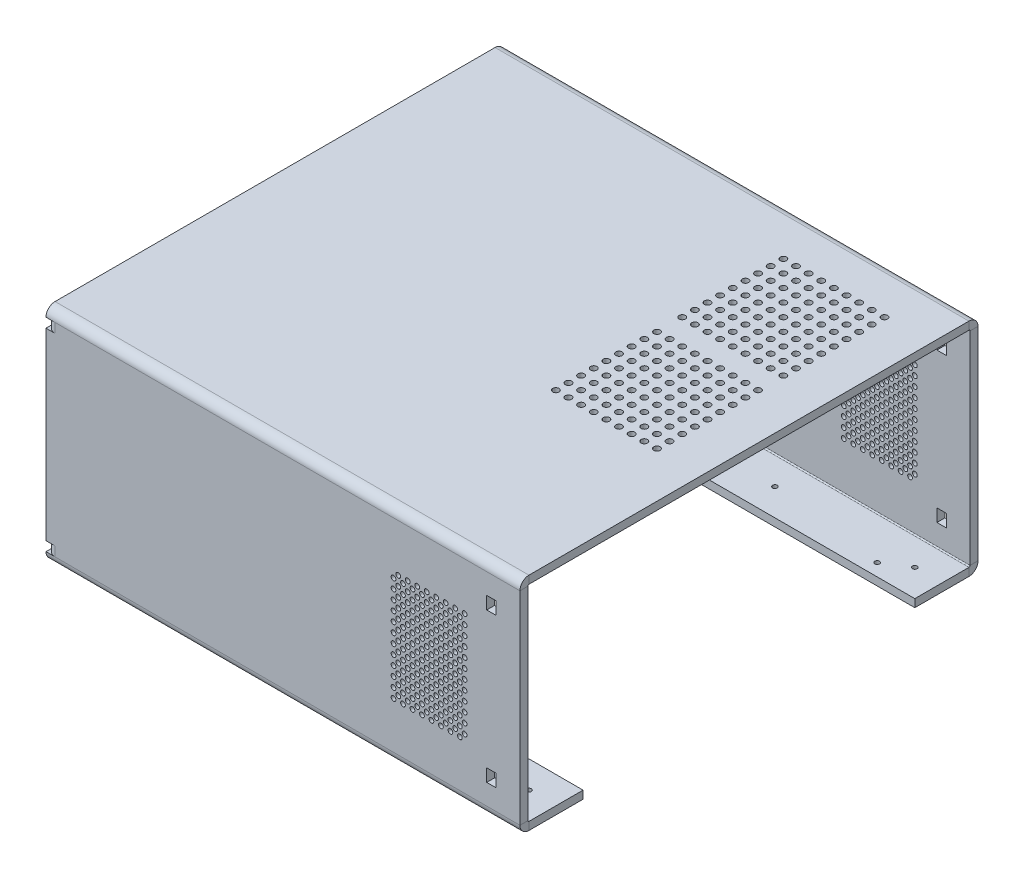
from build123d import *

# Parameters (mm, degrees)
SKETCH1_W                         = 300
SKETCH1_H                         = 280
TOP_SURFACE_DEPTH                 = 5
SIDES_STRIP_W                     = 21.4732
SIDES_STRIP_H                     = 5
SIDES_STRIP_CUT_DEPTH             = 300
SIDES_STRIP_2_W                   = 21.4732
SIDES_STRIP_2_H                   = 5
SIDES_STRIP_CUT_2_DEPTH           = 300
SIDES_DEPTH                       = 300
SIDES_BEND_DEPTH                  = 300
BOTTOM_SURFACES_STRIP_W           = 21.4732
BOTTOM_SURFACES_STRIP_H           = 5
BOTTOM_SURFACES_STRIP_CUT_DEPTH   = 300
BOTTOM_SURFACES_STRIP_2_W         = 21.4732
BOTTOM_SURFACES_STRIP_2_H         = 5
BOTTOM_SURFACES_STRIP_CUT_2_DEPTH = 300
BOTTOM_SURFACES_DEPTH             = 300
BOTTOM_SURFACES_BEND_DEPTH        = 300
SKETCH27_R                        = 1.5
SCREW_HOLES_BOTTOM_DEPTH          = 5
EDGE_FLANGE4_STRIP_W              = 21.4732
EDGE_FLANGE4_STRIP_H              = 5
EDGE_FLANGE4_STRIP_CUT_DEPTH      = 6
EDGE_FLANGE4_DEPTH                = 6
EDGE_FLANGE5_STRIP_W              = 21.4732
EDGE_FLANGE5_STRIP_H              = 5
EDGE_FLANGE5_STRIP_CUT_DEPTH      = 6
EDGE_FLANGE5_DEPTH                = 6
EDGE_FLANGE6_STRIP_W              = 21.4732
EDGE_FLANGE6_STRIP_H              = 5
EDGE_FLANGE6_STRIP_CUT_DEPTH      = 6
EDGE_FLANGE6_DEPTH                = 6
EDGE_FLANGE7_STRIP_W              = 21.4732
EDGE_FLANGE7_STRIP_H              = 5
EDGE_FLANGE7_STRIP_CUT_DEPTH      = 6
EDGE_FLANGE7_DEPTH                = 6
SKETCH40_R                        = 1.5
CUT_EXTRUDE3_DEPTH                = 5
SKETCH42_R                        = 1.5
SIDE_AIR_VENTS_DEPTH              = 441.113621693
SKETCH46_R                        = 2
TOP_AIR_VENTS_DEPTH               = 5
SNAP_HOOK_GROVES_REACH            = 442.114
SKETCH43_W                        = 6
SKETCH43_H                        = 8
SKETCH47_R                        = 1.5
CUT_EXTRUDE4_DEPTH                = 10


# Sheet-metal steps are written as plain solids
with BuildPart() as part:
    # Sketch1 → Top Surface (new body)
    with BuildSketch(Plane(origin=(0, 0, 0), x_dir=(1, 0, 0), z_dir=(0, 1, 0))):
        with Locations((150, -140)):
            Rectangle(SKETCH1_W, SKETCH1_H)
    extrude(amount=-TOP_SURFACE_DEPTH)

    # Sides strip (across the edge) → Sides strip cut (cut)
    with BuildSketch(Plane(origin=(300, -5, 280), x_dir=(0, 0, -1), z_dir=(-1, 0, 0))):
        with Locations((-10, -2.5)):
            Rectangle(SIDES_STRIP_W, SIDES_STRIP_H)
    extrude(amount=SIDES_STRIP_CUT_DEPTH, mode=Mode.SUBTRACT)

    # Sides strip 2 (across the edge) → Sides strip cut 2 (cut)
    with BuildSketch(Plane(origin=(0, -5, 0), x_dir=(0, 0, 1), z_dir=(1, 0, 0))):
        with Locations((-10, -2.5)):
            Rectangle(SIDES_STRIP_2_W, SIDES_STRIP_2_H)
    extrude(amount=SIDES_STRIP_CUT_2_DEPTH, mode=Mode.SUBTRACT)

    # Sides section (across the edge) → Sides (add)
    with BuildSketch(Plane(origin=(300, -5, 280), x_dir=(0, 0, -1), z_dir=(-1, 0, 0))):
        with BuildLine():
            Line((-5, 0.7366), (-5, 135))
            Line((-5, 135), (0, 135))
            Line((0, 135), (0, 0.7366))
            ThreePointArc((0, 0.7366), (0.215745145, 0.215745145), (0.7366, 0))
            Line((0.7366, 0), (0.7366, -5))
            ThreePointArc((0.7366, -5), (-3.319788761, -3.319788761), (-5, 0.7366))
        make_face()
    extrude(amount=SIDES_DEPTH)

    # Sides section 2 (across the edge) → Sides bend (add)
    with BuildSketch(Plane(origin=(0, -5, 0), x_dir=(0, 0, 1), z_dir=(1, 0, 0))):
        with BuildLine():
            Line((-5, 0.7366), (-5, 135))
            Line((-5, 135), (0, 135))
            Line((0, 135), (0, 0.7366))
            ThreePointArc((0, 0.7366), (0.215745145, 0.215745145), (0.7366, 0))
            Line((0.7366, 0), (0.7366, -5))
            ThreePointArc((0.7366, -5), (-3.319788761, -3.319788761), (-5, 0.7366))
        make_face()
    extrude(amount=SIDES_BEND_DEPTH)

    # Bottom surfaces strip (across the edge) → Bottom surfaces strip cut (cut)
    with BuildSketch(Plane(origin=(300, -140, 280), x_dir=(0, 1, 0), z_dir=(-1, 0, 0))):
        with Locations((-5, -2.5)):
            Rectangle(BOTTOM_SURFACES_STRIP_W, BOTTOM_SURFACES_STRIP_H)
    extrude(amount=BOTTOM_SURFACES_STRIP_CUT_DEPTH, mode=Mode.SUBTRACT)

    # Bottom surfaces strip 2 (across the edge) → Bottom surfaces strip cut 2 (cut)
    with BuildSketch(Plane(origin=(0, -140, 0), x_dir=(0, 1, 0), z_dir=(1, 0, 0))):
        with Locations((-5, -2.5)):
            Rectangle(BOTTOM_SURFACES_STRIP_2_W, BOTTOM_SURFACES_STRIP_2_H)
    extrude(amount=BOTTOM_SURFACES_STRIP_CUT_2_DEPTH, mode=Mode.SUBTRACT)

    # Bottom surfaces section (across the edge) → Bottom surfaces (add)
    with BuildSketch(Plane(origin=(300, -140, 280), x_dir=(0, 1, 0), z_dir=(-1, 0, 0))):
        with BuildLine():
            Line((0, 0.7366), (0, 35))
            Line((0, 35), (5, 35))
            Line((5, 35), (5, 0.7366))
            ThreePointArc((5, 0.7366), (5.215745145, 0.215745145), (5.7366, 0))
            Line((5.7366, 0), (5.7366, -5))
            ThreePointArc((5.7366, -5), (1.680211239, -3.319788761), (0, 0.7366))
        make_face()
    extrude(amount=BOTTOM_SURFACES_DEPTH)

    # Bottom surfaces section 2 (across the edge) → Bottom surfaces bend (add)
    with BuildSketch(Plane(origin=(0, -140, 0), x_dir=(0, 1, 0), z_dir=(1, 0, 0))):
        with BuildLine():
            Line((0, 0.7366), (0, 35))
            Line((0, 35), (5, 35))
            Line((5, 35), (5, 0.7366))
            ThreePointArc((5, 0.7366), (5.215745145, 0.215745145), (5.7366, 0))
            Line((5.7366, 0), (5.7366, -5))
            ThreePointArc((5.7366, -5), (1.680211239, -3.319788761), (0, 0.7366))
        make_face()
    extrude(amount=BOTTOM_SURFACES_BEND_DEPTH)

    # Sketch27 → Screw Holes Bottom (cut)
    with BuildSketch(Plane(origin=(0, -135, 0), x_dir=(1, 0, 0), z_dir=(0, 1, 0))):
        with Locations(Location((17.1317, -17.8683, 0), (0, 0, 270))):
            Circle(SKETCH27_R)
        with Locations(Location((105.710566667, -17.8683, 0), (0, 0, 270))):
            Circle(SKETCH27_R)
        with Locations(Location((194.289433333, -17.8683, 0), (0, 0, 270))):
            Circle(SKETCH27_R)
        with Locations(Location((282.8683, -17.8683, 0), (0, 0, 270))):
            Circle(SKETCH27_R)
        with Locations(Location((17.1317, -262.1317, 0), (0, 0, 270))):
            Circle(SKETCH27_R)
        with Locations(Location((105.710566667, -262.1317, 0), (0, 0, 270))):
            Circle(SKETCH27_R)
        with Locations(Location((194.289433333, -262.1317, 0), (0, 0, 270))):
            Circle(SKETCH27_R)
        with Locations(Location((282.8683, -262.1317, 0), (0, 0, 270))):
            Circle(SKETCH27_R)
    extrude(amount=-SCREW_HOLES_BOTTOM_DEPTH, mode=Mode.SUBTRACT)

    # Edge-Flange4 strip (across the edge) → Edge-Flange4 strip cut (cut)
    with BuildSketch(Plane(origin=(0, -11.7366, 280), x_dir=(1, 0, 0), z_dir=(0, 1, 0))):
        with Locations((-5, -2.5)):
            Rectangle(EDGE_FLANGE4_STRIP_W, EDGE_FLANGE4_STRIP_H)
    extrude(amount=EDGE_FLANGE4_STRIP_CUT_DEPTH, mode=Mode.SUBTRACT)

    # Edge-Flange4 section (across the edge) → Edge-Flange4 (add)
    with BuildSketch(Plane(origin=(0, -11.7366, 280), x_dir=(1, 0, 0), z_dir=(0, 1, 0))):
        with BuildLine():
            Line((0, 0.7366), (0, 6))
            Line((0, 6), (5, 6))
            Line((5, 6), (5, 0.7366))
            ThreePointArc((5, 0.7366), (5.215745145, 0.215745145), (5.7366, 0))
            Line((5.7366, 0), (5.7366, -5))
            ThreePointArc((5.7366, -5), (1.680211239, -3.319788761), (0, 0.7366))
        make_face()
    extrude(amount=EDGE_FLANGE4_DEPTH)

    # Edge-Flange5 strip (across the edge) → Edge-Flange5 strip cut (cut)
    with BuildSketch(Plane(origin=(0, -134.2634, 280), x_dir=(1, 0, 0), z_dir=(0, 1, 0))):
        with Locations((-5, -2.5)):
            Rectangle(EDGE_FLANGE5_STRIP_W, EDGE_FLANGE5_STRIP_H)
    extrude(amount=EDGE_FLANGE5_STRIP_CUT_DEPTH, mode=Mode.SUBTRACT)

    # Edge-Flange5 section (across the edge) → Edge-Flange5 (add)
    with BuildSketch(Plane(origin=(0, -134.2634, 280), x_dir=(1, 0, 0), z_dir=(0, 1, 0))):
        with BuildLine():
            Line((0, 0.7366), (0, 6))
            Line((0, 6), (5, 6))
            Line((5, 6), (5, 0.7366))
            ThreePointArc((5, 0.7366), (5.215745145, 0.215745145), (5.7366, 0))
            Line((5.7366, 0), (5.7366, -5))
            ThreePointArc((5.7366, -5), (1.680211239, -3.319788761), (0, 0.7366))
        make_face()
    extrude(amount=EDGE_FLANGE5_DEPTH)

    # Edge-Flange6 strip (across the edge) → Edge-Flange6 strip cut (cut)
    with BuildSketch(Plane.XZ.offset(128.2634)):
        with Locations((-5, -2.5)):
            Rectangle(EDGE_FLANGE6_STRIP_W, EDGE_FLANGE6_STRIP_H)
    extrude(amount=EDGE_FLANGE6_STRIP_CUT_DEPTH, mode=Mode.SUBTRACT)

    # Edge-Flange6 section (across the edge) → Edge-Flange6 (add)
    with BuildSketch(Plane.XZ.offset(128.2634)):
        with BuildLine():
            Line((0, 0.7366), (0, 6))
            Line((0, 6), (5, 6))
            Line((5, 6), (5, 0.7366))
            ThreePointArc((5, 0.7366), (5.215745145, 0.215745145), (5.7366, 0))
            Line((5.7366, 0), (5.7366, -5))
            ThreePointArc((5.7366, -5), (1.680211239, -3.319788761), (0, 0.7366))
        make_face()
    extrude(amount=EDGE_FLANGE6_DEPTH)

    # Edge-Flange7 strip (across the edge) → Edge-Flange7 strip cut (cut)
    with BuildSketch(Plane.XZ.offset(5.7366)):
        with Locations((-5, -2.5)):
            Rectangle(EDGE_FLANGE7_STRIP_W, EDGE_FLANGE7_STRIP_H)
    extrude(amount=EDGE_FLANGE7_STRIP_CUT_DEPTH, mode=Mode.SUBTRACT)

    # Edge-Flange7 section (across the edge) → Edge-Flange7 (add)
    with BuildSketch(Plane.XZ.offset(5.7366)):
        with BuildLine():
            Line((0, 0.7366), (0, 6))
            Line((0, 6), (5, 6))
            Line((5, 6), (5, 0.7366))
            ThreePointArc((5, 0.7366), (5.215745145, 0.215745145), (5.7366, 0))
            Line((5.7366, 0), (5.7366, -5))
            ThreePointArc((5.7366, -5), (1.680211239, -3.319788761), (0, 0.7366))
        make_face()
    extrude(amount=EDGE_FLANGE7_DEPTH)

    # Sketch40 → Cut-Extrude3 (cut)
    with BuildSketch(Plane.ZY):
        with Locations((3.3683, -8.7366)):
            Circle(SKETCH40_R)
        with Locations((3.3683, -131.2634)):
            Circle(SKETCH40_R)
        with Locations((276.6317, -8.7366)):
            Circle(SKETCH40_R)
        with Locations((276.6317, -131.2634)):
            Circle(SKETCH40_R)
    extrude(amount=-CUT_EXTRUDE3_DEPTH, mode=Mode.SUBTRACT)

    # Sketch42 → Side Air Vents (cut, through all)
    with BuildSketch(Plane(origin=(0, 0, -5), x_dir=(-1, 0, 0), z_dir=(0, 0, -1))):
        with Locations(Location((-265, -35.7366, 0), (0, 0, 90))):
            Circle(SKETCH42_R)
        with Locations(Location((-259, -35.7366, 0), (0, 0, 90))):
            Circle(SKETCH42_R)
        with Locations(Location((-253, -35.7366, 0), (0, 0, 90))):
            Circle(SKETCH42_R)
        with Locations(Location((-247, -35.7366, 0), (0, 0, 90))):
            Circle(SKETCH42_R)
        with Locations(Location((-241, -35.7366, 0), (0, 0, 90))):
            Circle(SKETCH42_R)
        with Locations(Location((-235, -35.7366, 0), (0, 0, 90))):
            Circle(SKETCH42_R)
        with Locations(Location((-229, -35.7366, 0), (0, 0, 90))):
            Circle(SKETCH42_R)
        with Locations(Location((-223, -35.7366, 0), (0, 0, 90))):
            Circle(SKETCH42_R)
        with Locations(Location((-262, -38.7366, 0), (0, 0, 90))):
            Circle(SKETCH42_R)
        with Locations(Location((-256, -38.7366, 0), (0, 0, 90))):
            Circle(SKETCH42_R)
        with Locations(Location((-250, -38.7366, 0), (0, 0, 90))):
            Circle(SKETCH42_R)
        with Locations(Location((-244, -38.7366, 0), (0, 0, 90))):
            Circle(SKETCH42_R)
        with Locations(Location((-238, -38.7366, 0), (0, 0, 90))):
            Circle(SKETCH42_R)
        with Locations(Location((-232, -38.7366, 0), (0, 0, 90))):
            Circle(SKETCH42_R)
        with Locations(Location((-226, -38.7366, 0), (0, 0, 90))):
            Circle(SKETCH42_R)
        with Locations(Location((-220, -38.7366, 0), (0, 0, 90))):
            Circle(SKETCH42_R)
        with Locations(Location((-265, -41.7366, 0), (0, 0, 90))):
            Circle(SKETCH42_R)
        with Locations(Location((-259, -41.7366, 0), (0, 0, 90))):
            Circle(SKETCH42_R)
        with Locations(Location((-253, -41.7366, 0), (0, 0, 90))):
            Circle(SKETCH42_R)
        with Locations(Location((-247, -41.7366, 0), (0, 0, 90))):
            Circle(SKETCH42_R)
        with Locations(Location((-241, -41.7366, 0), (0, 0, 90))):
            Circle(SKETCH42_R)
        with Locations(Location((-235, -41.7366, 0), (0, 0, 90))):
            Circle(SKETCH42_R)
        with Locations(Location((-229, -41.7366, 0), (0, 0, 90))):
            Circle(SKETCH42_R)
        with Locations(Location((-223, -41.7366, 0), (0, 0, 90))):
            Circle(SKETCH42_R)
        with Locations(Location((-262, -44.7366, 0), (0, 0, 90))):
            Circle(SKETCH42_R)
        with Locations(Location((-256, -44.7366, 0), (0, 0, 90))):
            Circle(SKETCH42_R)
        with Locations(Location((-250, -44.7366, 0), (0, 0, 90))):
            Circle(SKETCH42_R)
        with Locations(Location((-244, -44.7366, 0), (0, 0, 90))):
            Circle(SKETCH42_R)
        with Locations(Location((-238, -44.7366, 0), (0, 0, 90))):
            Circle(SKETCH42_R)
        with Locations(Location((-232, -44.7366, 0), (0, 0, 90))):
            Circle(SKETCH42_R)
        with Locations(Location((-226, -44.7366, 0), (0, 0, 90))):
            Circle(SKETCH42_R)
        with Locations(Location((-220, -44.7366, 0), (0, 0, 90))):
            Circle(SKETCH42_R)
        with Locations(Location((-265, -47.7366, 0), (0, 0, 90))):
            Circle(SKETCH42_R)
        with Locations(Location((-259, -47.7366, 0), (0, 0, 90))):
            Circle(SKETCH42_R)
        with Locations(Location((-253, -47.7366, 0), (0, 0, 90))):
            Circle(SKETCH42_R)
        with Locations(Location((-247, -47.7366, 0), (0, 0, 90))):
            Circle(SKETCH42_R)
        with Locations(Location((-241, -47.7366, 0), (0, 0, 90))):
            Circle(SKETCH42_R)
        with Locations(Location((-235, -47.7366, 0), (0, 0, 90))):
            Circle(SKETCH42_R)
        with Locations(Location((-229, -47.7366, 0), (0, 0, 90))):
            Circle(SKETCH42_R)
        with Locations(Location((-223, -47.7366, 0), (0, 0, 90))):
            Circle(SKETCH42_R)
        with Locations(Location((-262, -50.7366, 0), (0, 0, 90))):
            Circle(SKETCH42_R)
        with Locations(Location((-256, -50.7366, 0), (0, 0, 90))):
            Circle(SKETCH42_R)
        with Locations(Location((-250, -50.7366, 0), (0, 0, 90))):
            Circle(SKETCH42_R)
        with Locations(Location((-244, -50.7366, 0), (0, 0, 90))):
            Circle(SKETCH42_R)
        with Locations(Location((-238, -50.7366, 0), (0, 0, 90))):
            Circle(SKETCH42_R)
        with Locations(Location((-232, -50.7366, 0), (0, 0, 90))):
            Circle(SKETCH42_R)
        with Locations(Location((-226, -50.7366, 0), (0, 0, 90))):
            Circle(SKETCH42_R)
        with Locations(Location((-220, -50.7366, 0), (0, 0, 90))):
            Circle(SKETCH42_R)
        with Locations(Location((-265, -53.7366, 0), (0, 0, 90))):
            Circle(SKETCH42_R)
        with Locations(Location((-259, -53.7366, 0), (0, 0, 90))):
            Circle(SKETCH42_R)
        with Locations(Location((-253, -53.7366, 0), (0, 0, 90))):
            Circle(SKETCH42_R)
        with Locations(Location((-247, -53.7366, 0), (0, 0, 90))):
            Circle(SKETCH42_R)
        with Locations(Location((-241, -53.7366, 0), (0, 0, 90))):
            Circle(SKETCH42_R)
        with Locations(Location((-235, -53.7366, 0), (0, 0, 90))):
            Circle(SKETCH42_R)
        with Locations(Location((-229, -53.7366, 0), (0, 0, 90))):
            Circle(SKETCH42_R)
        with Locations(Location((-223, -53.7366, 0), (0, 0, 90))):
            Circle(SKETCH42_R)
        with Locations(Location((-262, -56.7366, 0), (0, 0, 90))):
            Circle(SKETCH42_R)
        with Locations(Location((-256, -56.7366, 0), (0, 0, 90))):
            Circle(SKETCH42_R)
        with Locations(Location((-250, -56.7366, 0), (0, 0, 90))):
            Circle(SKETCH42_R)
        with Locations(Location((-244, -56.7366, 0), (0, 0, 90))):
            Circle(SKETCH42_R)
        with Locations(Location((-238, -56.7366, 0), (0, 0, 90))):
            Circle(SKETCH42_R)
        with Locations(Location((-232, -56.7366, 0), (0, 0, 90))):
            Circle(SKETCH42_R)
        with Locations(Location((-226, -56.7366, 0), (0, 0, 90))):
            Circle(SKETCH42_R)
        with Locations(Location((-220, -56.7366, 0), (0, 0, 90))):
            Circle(SKETCH42_R)
        with Locations(Location((-265, -59.7366, 0), (0, 0, 90))):
            Circle(SKETCH42_R)
        with Locations(Location((-259, -59.7366, 0), (0, 0, 90))):
            Circle(SKETCH42_R)
        with Locations(Location((-253, -59.7366, 0), (0, 0, 90))):
            Circle(SKETCH42_R)
        with Locations(Location((-247, -59.7366, 0), (0, 0, 90))):
            Circle(SKETCH42_R)
        with Locations(Location((-241, -59.7366, 0), (0, 0, 90))):
            Circle(SKETCH42_R)
        with Locations(Location((-235, -59.7366, 0), (0, 0, 90))):
            Circle(SKETCH42_R)
        with Locations(Location((-229, -59.7366, 0), (0, 0, 90))):
            Circle(SKETCH42_R)
        with Locations(Location((-223, -59.7366, 0), (0, 0, 90))):
            Circle(SKETCH42_R)
        with Locations(Location((-262, -62.7366, 0), (0, 0, 90))):
            Circle(SKETCH42_R)
        with Locations(Location((-256, -62.7366, 0), (0, 0, 90))):
            Circle(SKETCH42_R)
        with Locations(Location((-250, -62.7366, 0), (0, 0, 90))):
            Circle(SKETCH42_R)
        with Locations(Location((-244, -62.7366, 0), (0, 0, 90))):
            Circle(SKETCH42_R)
        with Locations(Location((-238, -62.7366, 0), (0, 0, 90))):
            Circle(SKETCH42_R)
        with Locations(Location((-232, -62.7366, 0), (0, 0, 90))):
            Circle(SKETCH42_R)
        with Locations(Location((-226, -62.7366, 0), (0, 0, 90))):
            Circle(SKETCH42_R)
        with Locations(Location((-220, -62.7366, 0), (0, 0, 90))):
            Circle(SKETCH42_R)
        with Locations(Location((-265, -65.7366, 0), (0, 0, 90))):
            Circle(SKETCH42_R)
        with Locations(Location((-259, -65.7366, 0), (0, 0, 90))):
            Circle(SKETCH42_R)
        with Locations(Location((-253, -65.7366, 0), (0, 0, 90))):
            Circle(SKETCH42_R)
        with Locations(Location((-247, -65.7366, 0), (0, 0, 90))):
            Circle(SKETCH42_R)
        with Locations(Location((-241, -65.7366, 0), (0, 0, 90))):
            Circle(SKETCH42_R)
        with Locations(Location((-235, -65.7366, 0), (0, 0, 90))):
            Circle(SKETCH42_R)
        with Locations(Location((-229, -65.7366, 0), (0, 0, 90))):
            Circle(SKETCH42_R)
        with Locations(Location((-223, -65.7366, 0), (0, 0, 90))):
            Circle(SKETCH42_R)
        with Locations(Location((-262, -68.7366, 0), (0, 0, 90))):
            Circle(SKETCH42_R)
        with Locations(Location((-256, -68.7366, 0), (0, 0, 90))):
            Circle(SKETCH42_R)
        with Locations(Location((-250, -68.7366, 0), (0, 0, 90))):
            Circle(SKETCH42_R)
        with Locations(Location((-244, -68.7366, 0), (0, 0, 90))):
            Circle(SKETCH42_R)
        with Locations(Location((-238, -68.7366, 0), (0, 0, 90))):
            Circle(SKETCH42_R)
        with Locations(Location((-232, -68.7366, 0), (0, 0, 90))):
            Circle(SKETCH42_R)
        with Locations(Location((-226, -68.7366, 0), (0, 0, 90))):
            Circle(SKETCH42_R)
        with Locations(Location((-220, -68.7366, 0), (0, 0, 90))):
            Circle(SKETCH42_R)
        with Locations(Location((-265, -71.7366, 0), (0, 0, 90))):
            Circle(SKETCH42_R)
        with Locations(Location((-259, -71.7366, 0), (0, 0, 90))):
            Circle(SKETCH42_R)
        with Locations(Location((-253, -71.7366, 0), (0, 0, 90))):
            Circle(SKETCH42_R)
        with Locations(Location((-247, -71.7366, 0), (0, 0, 90))):
            Circle(SKETCH42_R)
        with Locations(Location((-241, -71.7366, 0), (0, 0, 90))):
            Circle(SKETCH42_R)
        with Locations(Location((-235, -71.7366, 0), (0, 0, 90))):
            Circle(SKETCH42_R)
        with Locations(Location((-229, -71.7366, 0), (0, 0, 90))):
            Circle(SKETCH42_R)
        with Locations(Location((-223, -71.7366, 0), (0, 0, 90))):
            Circle(SKETCH42_R)
        with Locations(Location((-262, -74.7366, 0), (0, 0, 90))):
            Circle(SKETCH42_R)
        with Locations(Location((-256, -74.7366, 0), (0, 0, 90))):
            Circle(SKETCH42_R)
        with Locations(Location((-250, -74.7366, 0), (0, 0, 90))):
            Circle(SKETCH42_R)
        with Locations(Location((-244, -74.7366, 0), (0, 0, 90))):
            Circle(SKETCH42_R)
        with Locations(Location((-238, -74.7366, 0), (0, 0, 90))):
            Circle(SKETCH42_R)
        with Locations(Location((-232, -74.7366, 0), (0, 0, 90))):
            Circle(SKETCH42_R)
        with Locations(Location((-226, -74.7366, 0), (0, 0, 90))):
            Circle(SKETCH42_R)
        with Locations(Location((-220, -74.7366, 0), (0, 0, 90))):
            Circle(SKETCH42_R)
        with Locations(Location((-265, -77.7366, 0), (0, 0, 90))):
            Circle(SKETCH42_R)
        with Locations(Location((-259, -77.7366, 0), (0, 0, 90))):
            Circle(SKETCH42_R)
        with Locations(Location((-253, -77.7366, 0), (0, 0, 90))):
            Circle(SKETCH42_R)
        with Locations(Location((-247, -77.7366, 0), (0, 0, 90))):
            Circle(SKETCH42_R)
        with Locations(Location((-241, -77.7366, 0), (0, 0, 90))):
            Circle(SKETCH42_R)
        with Locations(Location((-235, -77.7366, 0), (0, 0, 90))):
            Circle(SKETCH42_R)
        with Locations(Location((-229, -77.7366, 0), (0, 0, 90))):
            Circle(SKETCH42_R)
        with Locations(Location((-223, -77.7366, 0), (0, 0, 90))):
            Circle(SKETCH42_R)
        with Locations(Location((-262, -80.7366, 0), (0, 0, 90))):
            Circle(SKETCH42_R)
        with Locations(Location((-256, -80.7366, 0), (0, 0, 90))):
            Circle(SKETCH42_R)
        with Locations(Location((-250, -80.7366, 0), (0, 0, 90))):
            Circle(SKETCH42_R)
        with Locations(Location((-244, -80.7366, 0), (0, 0, 90))):
            Circle(SKETCH42_R)
        with Locations(Location((-238, -80.7366, 0), (0, 0, 90))):
            Circle(SKETCH42_R)
        with Locations(Location((-232, -80.7366, 0), (0, 0, 90))):
            Circle(SKETCH42_R)
        with Locations(Location((-226, -80.7366, 0), (0, 0, 90))):
            Circle(SKETCH42_R)
        with Locations(Location((-220, -80.7366, 0), (0, 0, 90))):
            Circle(SKETCH42_R)
        with Locations(Location((-265, -83.7366, 0), (0, 0, 90))):
            Circle(SKETCH42_R)
        with Locations(Location((-259, -83.7366, 0), (0, 0, 90))):
            Circle(SKETCH42_R)
        with Locations(Location((-253, -83.7366, 0), (0, 0, 90))):
            Circle(SKETCH42_R)
        with Locations(Location((-247, -83.7366, 0), (0, 0, 90))):
            Circle(SKETCH42_R)
        with Locations(Location((-241, -83.7366, 0), (0, 0, 90))):
            Circle(SKETCH42_R)
        with Locations(Location((-235, -83.7366, 0), (0, 0, 90))):
            Circle(SKETCH42_R)
        with Locations(Location((-229, -83.7366, 0), (0, 0, 90))):
            Circle(SKETCH42_R)
        with Locations(Location((-223, -83.7366, 0), (0, 0, 90))):
            Circle(SKETCH42_R)
        with Locations(Location((-262, -86.7366, 0), (0, 0, 90))):
            Circle(SKETCH42_R)
        with Locations(Location((-256, -86.7366, 0), (0, 0, 90))):
            Circle(SKETCH42_R)
        with Locations(Location((-250, -86.7366, 0), (0, 0, 90))):
            Circle(SKETCH42_R)
        with Locations(Location((-244, -86.7366, 0), (0, 0, 90))):
            Circle(SKETCH42_R)
        with Locations(Location((-238, -86.7366, 0), (0, 0, 90))):
            Circle(SKETCH42_R)
        with Locations(Location((-232, -86.7366, 0), (0, 0, 90))):
            Circle(SKETCH42_R)
        with Locations(Location((-226, -86.7366, 0), (0, 0, 90))):
            Circle(SKETCH42_R)
        with Locations(Location((-220, -86.7366, 0), (0, 0, 90))):
            Circle(SKETCH42_R)
        with Locations(Location((-265, -89.7366, 0), (0, 0, 90))):
            Circle(SKETCH42_R)
        with Locations(Location((-259, -89.7366, 0), (0, 0, 90))):
            Circle(SKETCH42_R)
        with Locations(Location((-253, -89.7366, 0), (0, 0, 90))):
            Circle(SKETCH42_R)
        with Locations(Location((-247, -89.7366, 0), (0, 0, 90))):
            Circle(SKETCH42_R)
        with Locations(Location((-241, -89.7366, 0), (0, 0, 90))):
            Circle(SKETCH42_R)
        with Locations(Location((-235, -89.7366, 0), (0, 0, 90))):
            Circle(SKETCH42_R)
        with Locations(Location((-229, -89.7366, 0), (0, 0, 90))):
            Circle(SKETCH42_R)
        with Locations(Location((-223, -89.7366, 0), (0, 0, 90))):
            Circle(SKETCH42_R)
        with Locations(Location((-262, -92.7366, 0), (0, 0, 90))):
            Circle(SKETCH42_R)
        with Locations(Location((-256, -92.7366, 0), (0, 0, 90))):
            Circle(SKETCH42_R)
        with Locations(Location((-250, -92.7366, 0), (0, 0, 90))):
            Circle(SKETCH42_R)
        with Locations(Location((-244, -92.7366, 0), (0, 0, 90))):
            Circle(SKETCH42_R)
        with Locations(Location((-238, -92.7366, 0), (0, 0, 90))):
            Circle(SKETCH42_R)
        with Locations(Location((-232, -92.7366, 0), (0, 0, 90))):
            Circle(SKETCH42_R)
        with Locations(Location((-226, -92.7366, 0), (0, 0, 90))):
            Circle(SKETCH42_R)
        with Locations(Location((-220, -92.7366, 0), (0, 0, 90))):
            Circle(SKETCH42_R)
        with Locations(Location((-265, -95.7366, 0), (0, 0, 90))):
            Circle(SKETCH42_R)
        with Locations(Location((-259, -95.7366, 0), (0, 0, 90))):
            Circle(SKETCH42_R)
        with Locations(Location((-253, -95.7366, 0), (0, 0, 90))):
            Circle(SKETCH42_R)
        with Locations(Location((-247, -95.7366, 0), (0, 0, 90))):
            Circle(SKETCH42_R)
        with Locations(Location((-241, -95.7366, 0), (0, 0, 90))):
            Circle(SKETCH42_R)
        with Locations(Location((-235, -95.7366, 0), (0, 0, 90))):
            Circle(SKETCH42_R)
        with Locations(Location((-229, -95.7366, 0), (0, 0, 90))):
            Circle(SKETCH42_R)
        with Locations(Location((-223, -95.7366, 0), (0, 0, 90))):
            Circle(SKETCH42_R)
        with Locations(Location((-262, -98.7366, 0), (0, 0, 90))):
            Circle(SKETCH42_R)
        with Locations(Location((-256, -98.7366, 0), (0, 0, 90))):
            Circle(SKETCH42_R)
        with Locations(Location((-250, -98.7366, 0), (0, 0, 90))):
            Circle(SKETCH42_R)
        with Locations(Location((-244, -98.7366, 0), (0, 0, 90))):
            Circle(SKETCH42_R)
        with Locations(Location((-238, -98.7366, 0), (0, 0, 90))):
            Circle(SKETCH42_R)
        with Locations(Location((-232, -98.7366, 0), (0, 0, 90))):
            Circle(SKETCH42_R)
        with Locations(Location((-226, -98.7366, 0), (0, 0, 90))):
            Circle(SKETCH42_R)
        with Locations(Location((-220, -98.7366, 0), (0, 0, 90))):
            Circle(SKETCH42_R)
        with Locations(Location((-265, -101.7366, 0), (0, 0, 90))):
            Circle(SKETCH42_R)
        with Locations(Location((-259, -101.7366, 0), (0, 0, 90))):
            Circle(SKETCH42_R)
        with Locations(Location((-253, -101.7366, 0), (0, 0, 90))):
            Circle(SKETCH42_R)
        with Locations(Location((-247, -101.7366, 0), (0, 0, 90))):
            Circle(SKETCH42_R)
        with Locations(Location((-241, -101.7366, 0), (0, 0, 90))):
            Circle(SKETCH42_R)
        with Locations(Location((-235, -101.7366, 0), (0, 0, 90))):
            Circle(SKETCH42_R)
        with Locations(Location((-229, -101.7366, 0), (0, 0, 90))):
            Circle(SKETCH42_R)
        with Locations(Location((-223, -101.7366, 0), (0, 0, 90))):
            Circle(SKETCH42_R)
        with Locations(Location((-262, -104.7366, 0), (0, 0, 90))):
            Circle(SKETCH42_R)
        with Locations(Location((-256, -104.7366, 0), (0, 0, 90))):
            Circle(SKETCH42_R)
        with Locations(Location((-250, -104.7366, 0), (0, 0, 90))):
            Circle(SKETCH42_R)
        with Locations(Location((-244, -104.7366, 0), (0, 0, 90))):
            Circle(SKETCH42_R)
        with Locations(Location((-238, -104.7366, 0), (0, 0, 90))):
            Circle(SKETCH42_R)
        with Locations(Location((-232, -104.7366, 0), (0, 0, 90))):
            Circle(SKETCH42_R)
        with Locations(Location((-226, -104.7366, 0), (0, 0, 90))):
            Circle(SKETCH42_R)
        with Locations(Location((-220, -104.7366, 0), (0, 0, 90))):
            Circle(SKETCH42_R)
    extrude(amount=-SIDE_AIR_VENTS_DEPTH, mode=Mode.SUBTRACT)

    # Sketch46 → Top Air Vents (cut)
    with BuildSketch(Plane(origin=(0, 0, 0), x_dir=(1, 0, 0), z_dir=(0, 1, 0))):
        with Locations(Location((207.121408263, -25.366768147, 0), (0, 0, 270))):
            Circle(SKETCH46_R)
        with Locations(Location((207.121408263, -33.366768147, 0), (0, 0, 270))):
            Circle(SKETCH46_R)
        with Locations(Location((207.121408263, -41.366768147, 0), (0, 0, 270))):
            Circle(SKETCH46_R)
        with Locations(Location((207.121408263, -49.366768147, 0), (0, 0, 270))):
            Circle(SKETCH46_R)
        with Locations(Location((207.121408263, -57.366768147, 0), (0, 0, 270))):
            Circle(SKETCH46_R)
        with Locations(Location((207.121408263, -65.366768147, 0), (0, 0, 270))):
            Circle(SKETCH46_R)
        with Locations(Location((207.121408263, -73.366768147, 0), (0, 0, 270))):
            Circle(SKETCH46_R)
        with Locations(Location((207.121408263, -81.366768147, 0), (0, 0, 270))):
            Circle(SKETCH46_R)
        with Locations(Location((207.121408263, -89.366768147, 0), (0, 0, 270))):
            Circle(SKETCH46_R)
        with Locations(Location((215.121408263, -25.366768147, 0), (0, 0, 270))):
            Circle(SKETCH46_R)
        with Locations(Location((215.121408263, -33.366768147, 0), (0, 0, 270))):
            Circle(SKETCH46_R)
        with Locations(Location((215.121408263, -41.366768147, 0), (0, 0, 270))):
            Circle(SKETCH46_R)
        with Locations(Location((215.121408263, -49.366768147, 0), (0, 0, 270))):
            Circle(SKETCH46_R)
        with Locations(Location((215.121408263, -57.366768147, 0), (0, 0, 270))):
            Circle(SKETCH46_R)
        with Locations(Location((215.121408263, -65.366768147, 0), (0, 0, 270))):
            Circle(SKETCH46_R)
        with Locations(Location((215.121408263, -73.366768147, 0), (0, 0, 270))):
            Circle(SKETCH46_R)
        with Locations(Location((215.121408263, -81.366768147, 0), (0, 0, 270))):
            Circle(SKETCH46_R)
        with Locations(Location((215.121408263, -89.366768147, 0), (0, 0, 270))):
            Circle(SKETCH46_R)
        with Locations(Location((223.121408263, -25.366768147, 0), (0, 0, 270))):
            Circle(SKETCH46_R)
        with Locations(Location((223.121408263, -33.366768147, 0), (0, 0, 270))):
            Circle(SKETCH46_R)
        with Locations(Location((223.121408263, -41.366768147, 0), (0, 0, 270))):
            Circle(SKETCH46_R)
        with Locations(Location((223.121408263, -49.366768147, 0), (0, 0, 270))):
            Circle(SKETCH46_R)
        with Locations(Location((223.121408263, -57.366768147, 0), (0, 0, 270))):
            Circle(SKETCH46_R)
        with Locations(Location((223.121408263, -65.366768147, 0), (0, 0, 270))):
            Circle(SKETCH46_R)
        with Locations(Location((223.121408263, -73.366768147, 0), (0, 0, 270))):
            Circle(SKETCH46_R)
        with Locations(Location((223.121408263, -81.366768147, 0), (0, 0, 270))):
            Circle(SKETCH46_R)
        with Locations(Location((223.121408263, -89.366768147, 0), (0, 0, 270))):
            Circle(SKETCH46_R)
        with Locations(Location((231.121408263, -25.366768147, 0), (0, 0, 270))):
            Circle(SKETCH46_R)
        with Locations(Location((231.121408263, -33.366768147, 0), (0, 0, 270))):
            Circle(SKETCH46_R)
        with Locations(Location((231.121408263, -41.366768147, 0), (0, 0, 270))):
            Circle(SKETCH46_R)
        with Locations(Location((231.121408263, -49.366768147, 0), (0, 0, 270))):
            Circle(SKETCH46_R)
        with Locations(Location((231.121408263, -57.366768147, 0), (0, 0, 270))):
            Circle(SKETCH46_R)
        with Locations(Location((231.121408263, -65.366768147, 0), (0, 0, 270))):
            Circle(SKETCH46_R)
        with Locations(Location((231.121408263, -73.366768147, 0), (0, 0, 270))):
            Circle(SKETCH46_R)
        with Locations(Location((231.121408263, -81.366768147, 0), (0, 0, 270))):
            Circle(SKETCH46_R)
        with Locations(Location((231.121408263, -89.366768147, 0), (0, 0, 270))):
            Circle(SKETCH46_R)
        with Locations(Location((239.121408263, -25.366768147, 0), (0, 0, 270))):
            Circle(SKETCH46_R)
        with Locations(Location((239.121408263, -33.366768147, 0), (0, 0, 270))):
            Circle(SKETCH46_R)
        with Locations(Location((239.121408263, -41.366768147, 0), (0, 0, 270))):
            Circle(SKETCH46_R)
        with Locations(Location((239.121408263, -49.366768147, 0), (0, 0, 270))):
            Circle(SKETCH46_R)
        with Locations(Location((239.121408263, -57.366768147, 0), (0, 0, 270))):
            Circle(SKETCH46_R)
        with Locations(Location((239.121408263, -65.366768147, 0), (0, 0, 270))):
            Circle(SKETCH46_R)
        with Locations(Location((239.121408263, -73.366768147, 0), (0, 0, 270))):
            Circle(SKETCH46_R)
        with Locations(Location((239.121408263, -81.366768147, 0), (0, 0, 270))):
            Circle(SKETCH46_R)
        with Locations(Location((239.121408263, -89.366768147, 0), (0, 0, 270))):
            Circle(SKETCH46_R)
        with Locations(Location((247.121408263, -25.366768147, 0), (0, 0, 270))):
            Circle(SKETCH46_R)
        with Locations(Location((247.121408263, -33.366768147, 0), (0, 0, 270))):
            Circle(SKETCH46_R)
        with Locations(Location((247.121408263, -41.366768147, 0), (0, 0, 270))):
            Circle(SKETCH46_R)
        with Locations(Location((247.121408263, -49.366768147, 0), (0, 0, 270))):
            Circle(SKETCH46_R)
        with Locations(Location((247.121408263, -57.366768147, 0), (0, 0, 270))):
            Circle(SKETCH46_R)
        with Locations(Location((247.121408263, -65.366768147, 0), (0, 0, 270))):
            Circle(SKETCH46_R)
        with Locations(Location((247.121408263, -73.366768147, 0), (0, 0, 270))):
            Circle(SKETCH46_R)
        with Locations(Location((247.121408263, -81.366768147, 0), (0, 0, 270))):
            Circle(SKETCH46_R)
        with Locations(Location((247.121408263, -89.366768147, 0), (0, 0, 270))):
            Circle(SKETCH46_R)
        with Locations(Location((255.121408263, -25.366768147, 0), (0, 0, 270))):
            Circle(SKETCH46_R)
        with Locations(Location((255.121408263, -33.366768147, 0), (0, 0, 270))):
            Circle(SKETCH46_R)
        with Locations(Location((255.121408263, -41.366768147, 0), (0, 0, 270))):
            Circle(SKETCH46_R)
        with Locations(Location((255.121408263, -49.366768147, 0), (0, 0, 270))):
            Circle(SKETCH46_R)
        with Locations(Location((255.121408263, -57.366768147, 0), (0, 0, 270))):
            Circle(SKETCH46_R)
        with Locations(Location((255.121408263, -65.366768147, 0), (0, 0, 270))):
            Circle(SKETCH46_R)
        with Locations(Location((255.121408263, -73.366768147, 0), (0, 0, 270))):
            Circle(SKETCH46_R)
        with Locations(Location((255.121408263, -81.366768147, 0), (0, 0, 270))):
            Circle(SKETCH46_R)
        with Locations(Location((255.121408263, -89.366768147, 0), (0, 0, 270))):
            Circle(SKETCH46_R)
        with Locations(Location((263.121408263, -25.366768147, 0), (0, 0, 270))):
            Circle(SKETCH46_R)
        with Locations(Location((263.121408263, -33.366768147, 0), (0, 0, 270))):
            Circle(SKETCH46_R)
        with Locations(Location((263.121408263, -41.366768147, 0), (0, 0, 270))):
            Circle(SKETCH46_R)
        with Locations(Location((263.121408263, -49.366768147, 0), (0, 0, 270))):
            Circle(SKETCH46_R)
        with Locations(Location((263.121408263, -57.366768147, 0), (0, 0, 270))):
            Circle(SKETCH46_R)
        with Locations(Location((263.121408263, -65.366768147, 0), (0, 0, 270))):
            Circle(SKETCH46_R)
        with Locations(Location((263.121408263, -73.366768147, 0), (0, 0, 270))):
            Circle(SKETCH46_R)
        with Locations(Location((263.121408263, -81.366768147, 0), (0, 0, 270))):
            Circle(SKETCH46_R)
        with Locations(Location((263.121408263, -89.366768147, 0), (0, 0, 270))):
            Circle(SKETCH46_R)
        with Locations(Location((271.121408263, -25.366768147, 0), (0, 0, 270))):
            Circle(SKETCH46_R)
        with Locations(Location((271.121408263, -33.366768147, 0), (0, 0, 270))):
            Circle(SKETCH46_R)
        with Locations(Location((271.121408263, -41.366768147, 0), (0, 0, 270))):
            Circle(SKETCH46_R)
        with Locations(Location((271.121408263, -49.366768147, 0), (0, 0, 270))):
            Circle(SKETCH46_R)
        with Locations(Location((271.121408263, -57.366768147, 0), (0, 0, 270))):
            Circle(SKETCH46_R)
        with Locations(Location((271.121408263, -65.366768147, 0), (0, 0, 270))):
            Circle(SKETCH46_R)
        with Locations(Location((271.121408263, -73.366768147, 0), (0, 0, 270))):
            Circle(SKETCH46_R)
        with Locations(Location((271.121408263, -81.366768147, 0), (0, 0, 270))):
            Circle(SKETCH46_R)
        with Locations(Location((271.121408263, -89.366768147, 0), (0, 0, 270))):
            Circle(SKETCH46_R)
        with Locations(Location((207.121408263, -105.366768147, 0), (0, 0, 270))):
            Circle(SKETCH46_R)
        with Locations(Location((207.121408263, -113.366768147, 0), (0, 0, 270))):
            Circle(SKETCH46_R)
        with Locations(Location((207.121408263, -121.366768147, 0), (0, 0, 270))):
            Circle(SKETCH46_R)
        with Locations(Location((207.121408263, -129.366768147, 0), (0, 0, 270))):
            Circle(SKETCH46_R)
        with Locations(Location((207.121408263, -137.366768147, 0), (0, 0, 270))):
            Circle(SKETCH46_R)
        with Locations(Location((207.121408263, -145.366768147, 0), (0, 0, 270))):
            Circle(SKETCH46_R)
        with Locations(Location((207.121408263, -153.366768147, 0), (0, 0, 270))):
            Circle(SKETCH46_R)
        with Locations(Location((207.121408263, -161.366768147, 0), (0, 0, 270))):
            Circle(SKETCH46_R)
        with Locations(Location((207.121408263, -169.366768147, 0), (0, 0, 270))):
            Circle(SKETCH46_R)
        with Locations(Location((215.121408263, -105.366768147, 0), (0, 0, 270))):
            Circle(SKETCH46_R)
        with Locations(Location((215.121408263, -113.366768147, 0), (0, 0, 270))):
            Circle(SKETCH46_R)
        with Locations(Location((215.121408263, -121.366768147, 0), (0, 0, 270))):
            Circle(SKETCH46_R)
        with Locations(Location((215.121408263, -129.366768147, 0), (0, 0, 270))):
            Circle(SKETCH46_R)
        with Locations(Location((215.121408263, -137.366768147, 0), (0, 0, 270))):
            Circle(SKETCH46_R)
        with Locations(Location((215.121408263, -145.366768147, 0), (0, 0, 270))):
            Circle(SKETCH46_R)
        with Locations(Location((215.121408263, -153.366768147, 0), (0, 0, 270))):
            Circle(SKETCH46_R)
        with Locations(Location((215.121408263, -161.366768147, 0), (0, 0, 270))):
            Circle(SKETCH46_R)
        with Locations(Location((215.121408263, -169.366768147, 0), (0, 0, 270))):
            Circle(SKETCH46_R)
        with Locations(Location((223.121408263, -105.366768147, 0), (0, 0, 270))):
            Circle(SKETCH46_R)
        with Locations(Location((223.121408263, -113.366768147, 0), (0, 0, 270))):
            Circle(SKETCH46_R)
        with Locations(Location((223.121408263, -121.366768147, 0), (0, 0, 270))):
            Circle(SKETCH46_R)
        with Locations(Location((223.121408263, -129.366768147, 0), (0, 0, 270))):
            Circle(SKETCH46_R)
        with Locations(Location((223.121408263, -137.366768147, 0), (0, 0, 270))):
            Circle(SKETCH46_R)
        with Locations(Location((223.121408263, -145.366768147, 0), (0, 0, 270))):
            Circle(SKETCH46_R)
        with Locations(Location((223.121408263, -153.366768147, 0), (0, 0, 270))):
            Circle(SKETCH46_R)
        with Locations(Location((223.121408263, -161.366768147, 0), (0, 0, 270))):
            Circle(SKETCH46_R)
        with Locations(Location((223.121408263, -169.366768147, 0), (0, 0, 270))):
            Circle(SKETCH46_R)
        with Locations(Location((231.121408263, -105.366768147, 0), (0, 0, 270))):
            Circle(SKETCH46_R)
        with Locations(Location((231.121408263, -113.366768147, 0), (0, 0, 270))):
            Circle(SKETCH46_R)
        with Locations(Location((231.121408263, -121.366768147, 0), (0, 0, 270))):
            Circle(SKETCH46_R)
        with Locations(Location((231.121408263, -129.366768147, 0), (0, 0, 270))):
            Circle(SKETCH46_R)
        with Locations(Location((231.121408263, -137.366768147, 0), (0, 0, 270))):
            Circle(SKETCH46_R)
        with Locations(Location((231.121408263, -145.366768147, 0), (0, 0, 270))):
            Circle(SKETCH46_R)
        with Locations(Location((231.121408263, -153.366768147, 0), (0, 0, 270))):
            Circle(SKETCH46_R)
        with Locations(Location((231.121408263, -161.366768147, 0), (0, 0, 270))):
            Circle(SKETCH46_R)
        with Locations(Location((231.121408263, -169.366768147, 0), (0, 0, 270))):
            Circle(SKETCH46_R)
        with Locations(Location((239.121408263, -105.366768147, 0), (0, 0, 270))):
            Circle(SKETCH46_R)
        with Locations(Location((239.121408263, -113.366768147, 0), (0, 0, 270))):
            Circle(SKETCH46_R)
        with Locations(Location((239.121408263, -121.366768147, 0), (0, 0, 270))):
            Circle(SKETCH46_R)
        with Locations(Location((239.121408263, -129.366768147, 0), (0, 0, 270))):
            Circle(SKETCH46_R)
        with Locations(Location((239.121408263, -137.366768147, 0), (0, 0, 270))):
            Circle(SKETCH46_R)
        with Locations(Location((239.121408263, -145.366768147, 0), (0, 0, 270))):
            Circle(SKETCH46_R)
        with Locations(Location((239.121408263, -153.366768147, 0), (0, 0, 270))):
            Circle(SKETCH46_R)
        with Locations(Location((239.121408263, -161.366768147, 0), (0, 0, 270))):
            Circle(SKETCH46_R)
        with Locations(Location((239.121408263, -169.366768147, 0), (0, 0, 270))):
            Circle(SKETCH46_R)
        with Locations(Location((247.121408263, -105.366768147, 0), (0, 0, 270))):
            Circle(SKETCH46_R)
        with Locations(Location((247.121408263, -113.366768147, 0), (0, 0, 270))):
            Circle(SKETCH46_R)
        with Locations(Location((247.121408263, -121.366768147, 0), (0, 0, 270))):
            Circle(SKETCH46_R)
        with Locations(Location((247.121408263, -129.366768147, 0), (0, 0, 270))):
            Circle(SKETCH46_R)
        with Locations(Location((247.121408263, -137.366768147, 0), (0, 0, 270))):
            Circle(SKETCH46_R)
        with Locations(Location((247.121408263, -145.366768147, 0), (0, 0, 270))):
            Circle(SKETCH46_R)
        with Locations(Location((247.121408263, -153.366768147, 0), (0, 0, 270))):
            Circle(SKETCH46_R)
        with Locations(Location((247.121408263, -161.366768147, 0), (0, 0, 270))):
            Circle(SKETCH46_R)
        with Locations(Location((247.121408263, -169.366768147, 0), (0, 0, 270))):
            Circle(SKETCH46_R)
        with Locations(Location((255.121408263, -105.366768147, 0), (0, 0, 270))):
            Circle(SKETCH46_R)
        with Locations(Location((255.121408263, -113.366768147, 0), (0, 0, 270))):
            Circle(SKETCH46_R)
        with Locations(Location((255.121408263, -121.366768147, 0), (0, 0, 270))):
            Circle(SKETCH46_R)
        with Locations(Location((255.121408263, -129.366768147, 0), (0, 0, 270))):
            Circle(SKETCH46_R)
        with Locations(Location((255.121408263, -137.366768147, 0), (0, 0, 270))):
            Circle(SKETCH46_R)
        with Locations(Location((255.121408263, -145.366768147, 0), (0, 0, 270))):
            Circle(SKETCH46_R)
        with Locations(Location((255.121408263, -153.366768147, 0), (0, 0, 270))):
            Circle(SKETCH46_R)
        with Locations(Location((255.121408263, -161.366768147, 0), (0, 0, 270))):
            Circle(SKETCH46_R)
        with Locations(Location((255.121408263, -169.366768147, 0), (0, 0, 270))):
            Circle(SKETCH46_R)
        with Locations(Location((263.121408263, -105.366768147, 0), (0, 0, 270))):
            Circle(SKETCH46_R)
        with Locations(Location((263.121408263, -113.366768147, 0), (0, 0, 270))):
            Circle(SKETCH46_R)
        with Locations(Location((263.121408263, -121.366768147, 0), (0, 0, 270))):
            Circle(SKETCH46_R)
        with Locations(Location((263.121408263, -129.366768147, 0), (0, 0, 270))):
            Circle(SKETCH46_R)
        with Locations(Location((263.121408263, -137.366768147, 0), (0, 0, 270))):
            Circle(SKETCH46_R)
        with Locations(Location((263.121408263, -145.366768147, 0), (0, 0, 270))):
            Circle(SKETCH46_R)
        with Locations(Location((263.121408263, -153.366768147, 0), (0, 0, 270))):
            Circle(SKETCH46_R)
        with Locations(Location((263.121408263, -161.366768147, 0), (0, 0, 270))):
            Circle(SKETCH46_R)
        with Locations(Location((263.121408263, -169.366768147, 0), (0, 0, 270))):
            Circle(SKETCH46_R)
        with Locations(Location((271.121408263, -105.366768147, 0), (0, 0, 270))):
            Circle(SKETCH46_R)
        with Locations(Location((271.121408263, -113.366768147, 0), (0, 0, 270))):
            Circle(SKETCH46_R)
        with Locations(Location((271.121408263, -121.366768147, 0), (0, 0, 270))):
            Circle(SKETCH46_R)
        with Locations(Location((271.121408263, -129.366768147, 0), (0, 0, 270))):
            Circle(SKETCH46_R)
        with Locations(Location((271.121408263, -137.366768147, 0), (0, 0, 270))):
            Circle(SKETCH46_R)
        with Locations(Location((271.121408263, -145.366768147, 0), (0, 0, 270))):
            Circle(SKETCH46_R)
        with Locations(Location((271.121408263, -153.366768147, 0), (0, 0, 270))):
            Circle(SKETCH46_R)
        with Locations(Location((271.121408263, -161.366768147, 0), (0, 0, 270))):
            Circle(SKETCH46_R)
        with Locations(Location((271.121408263, -169.366768147, 0), (0, 0, 270))):
            Circle(SKETCH46_R)
    extrude(amount=-TOP_AIR_VENTS_DEPTH, mode=Mode.SUBTRACT)

    # Snap Hook Groves: up to this face of the body (flat: up to its plane)
    snap_hook_groves_end = Plane(part.part.faces().sort_by_distance((146.891912311, -69.99135232, -5))[0])
    # Sketch43 → Snap Hook Groves (cut, up to the picked face)
    with BuildSketch(Plane.XY.offset(285), mode=Mode.PRIVATE) as snap_hook_groves_sk1:
        with Locations((282, -22.7366)):
            Rectangle(SKETCH43_W, SKETCH43_H)
    snap_hook_groves_tool1 = split(extrude(snap_hook_groves_sk1.sketch, amount=-SNAP_HOOK_GROVES_REACH, mode=Mode.PRIVATE), bisect_by=snap_hook_groves_end, keep=Keep.BOTH, mode=Mode.PRIVATE)
    # Sketch43 → Snap Hook Groves (cut, up to the picked face)
    with BuildSketch(Plane.XY.offset(285), mode=Mode.PRIVATE) as snap_hook_groves_sk2:
        with Locations((282, -117.2634)):
            Rectangle(SKETCH43_W, SKETCH43_H)
    snap_hook_groves_tool2 = split(extrude(snap_hook_groves_sk2.sketch, amount=-SNAP_HOOK_GROVES_REACH, mode=Mode.PRIVATE), bisect_by=snap_hook_groves_end, keep=Keep.BOTH, mode=Mode.PRIVATE)
    add(snap_hook_groves_tool1.solids().sort_by(Axis((282, -22.7366, 285), (0, 0, -1)))[0], mode=Mode.SUBTRACT)
    add(snap_hook_groves_tool2.solids().sort_by(Axis((282, -117.2634, 285), (0, 0, -1)))[0], mode=Mode.SUBTRACT)

    # Sketch47 → Cut-Extrude4 (cut)
    with BuildSketch(Plane(origin=(0, -135, 0), x_dir=(1, 0, 0), z_dir=(0, 1, 0))):
        with Locations(Location((268.313, -27.132248658, 0), (0, 0, 270))):
            Circle(SKETCH47_R)
        with Locations(Location((31.763, -27.132248658, 0), (0, 0, 270))):
            Circle(SKETCH47_R)
    extrude(amount=-CUT_EXTRUDE4_DEPTH, mode=Mode.SUBTRACT)


solid = part.part
